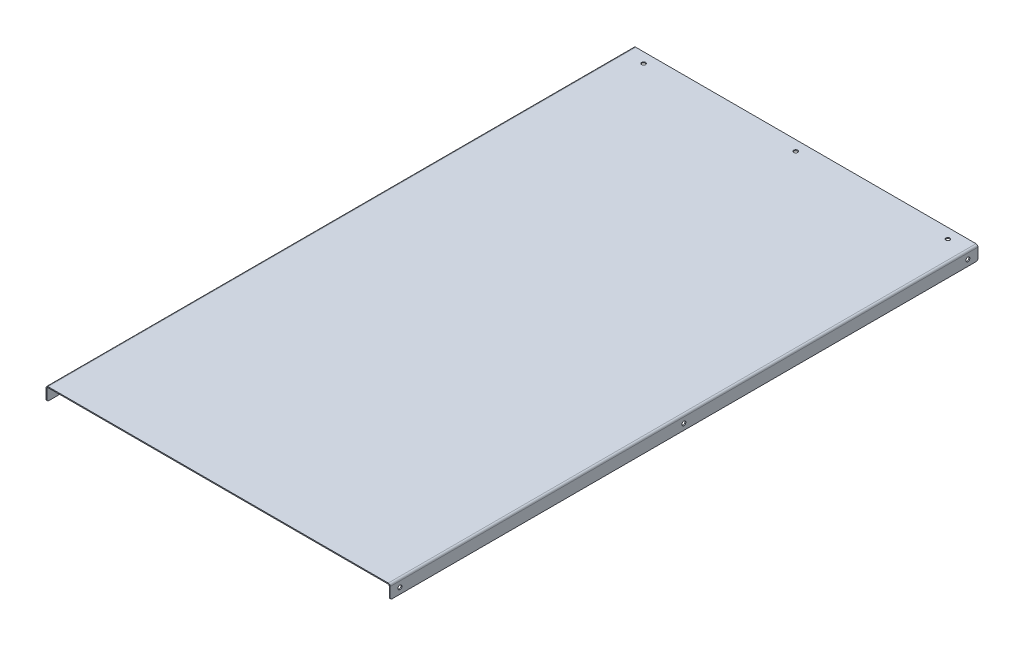
from build123d import *

# Parameters (mm, degrees)
BASE_FLANGE1_DEPTH = 736.092
FILLET1_R          = 2.54
SKETCH3_R          = 2.4765
CUT_EXTRUDE1_DEPTH = 854.182865261
SKETCH4_R          = 2.4765
CUT_EXTRUDE2_DEPTH = 1.2192


# Sheet-metal steps are written as plain solids
with BuildPart() as part:
    # Sketch1 → Base-Flange1 (new body)
    with BuildSketch(Plane.XY):
        with BuildLine():
            Line((-214.3252, -15.875), (-214.3252, -1.27))
            ThreePointArc((-214.3252, -1.27), (-213.953225612, -0.371974388), (-213.0552, 0))
            Line((-213.0552, 0), (213.0552, 0))
            ThreePointArc((213.0552, 0), (213.953225612, -0.371974388), (214.3252, -1.27))
            Line((214.3252, -1.27), (214.3252, -15.875))
            Line((214.3252, -15.875), (215.5444, -15.875))
            Line((215.5444, -15.875), (215.5444, -1.27))
            ThreePointArc((215.5444, -1.27), (214.8153302, 0.4901302), (213.0552, 1.2192))
            Line((213.0552, 1.2192), (-213.0552, 1.2192))
            ThreePointArc((-213.0552, 1.2192), (-214.8153302, 0.4901302), (-215.5444, -1.27))
            Line((-215.5444, -1.27), (-215.5444, -15.875))
            Line((-215.5444, -15.875), (-214.3252, -15.875))
        make_face()
    extrude(amount=BASE_FLANGE1_DEPTH)

    # Fillet1
    fillet1_edges = [part.edges().sort_by_distance(p)[0] for p in [
        (-214.9348, -15.875, 0),
        (214.9348, -15.875, 0),
        (214.9348, -15.875, 736.092),
        (-214.9348, -15.875, 736.092),
    ]]
    fillet(fillet1_edges, radius=FILLET1_R)

    # Sketch3 → Cut-Extrude1 (cut, through all)
    with BuildSketch(Plane(origin=(215.5444, 0, 0), x_dir=(0, 0, -1), z_dir=(1, 0, 0))):
        with Locations((-368.3, -8.3058)):
            Circle(SKETCH3_R)
        with Locations((-723.9, -8.3058)):
            Circle(SKETCH3_R)
        with Locations((-12.7, -8.3058)):
            Circle(SKETCH3_R)
    extrude(amount=-CUT_EXTRUDE1_DEPTH, mode=Mode.SUBTRACT)

    # Sketch4 → Cut-Extrude2 (cut)
    with BuildSketch(Plane(origin=(0, 1.2192, 0), x_dir=(1, 0, 0), z_dir=(0, 1, 0))):
        with Locations(Location((-190.5, -12.7, 0), (0, 0, 180))):
            Circle(SKETCH4_R)
        with Locations(Location((0, -12.7, 0), (0, 0, 180))):
            Circle(SKETCH4_R)
        with Locations(Location((190.5, -12.7, 0), (0, 0, 180))):
            Circle(SKETCH4_R)
    extrude(amount=-CUT_EXTRUDE2_DEPTH, mode=Mode.SUBTRACT)


solid = part.part
